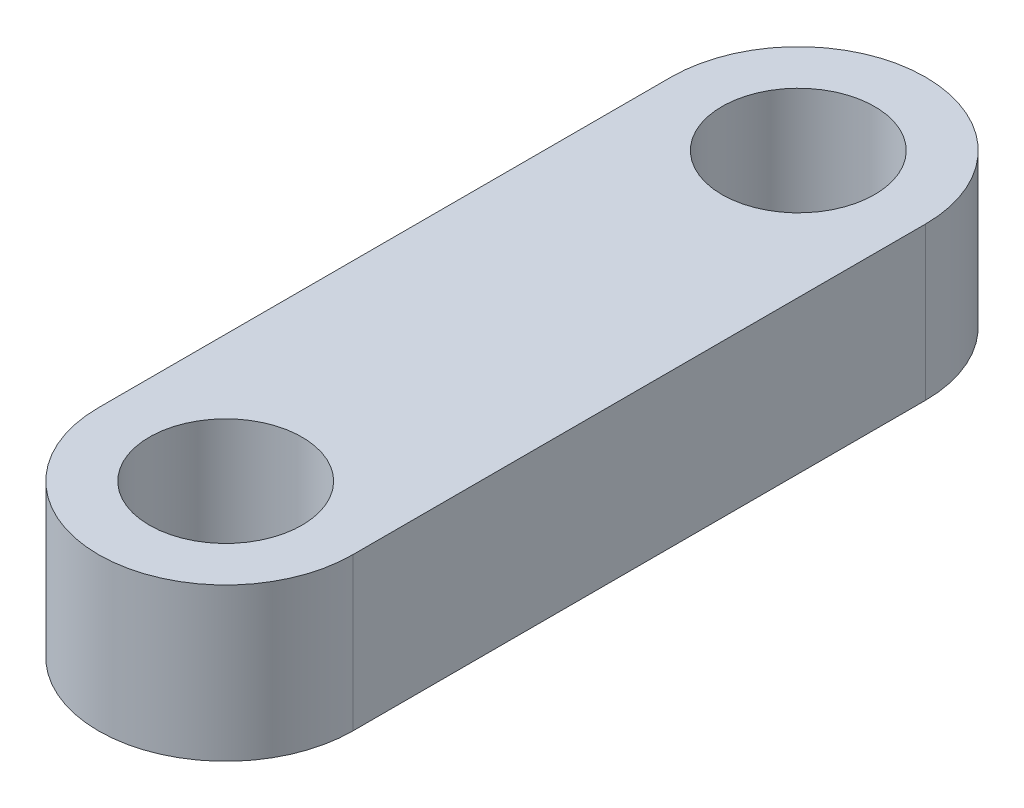
from build123d import *

# Parameters (mm, degrees)
SKETCH1_R           = 3
BOSS_EXTRUDE1_DEPTH = 6


with BuildPart() as part:
    # Sketch1 → Boss-Extrude1 (new body)
    with BuildSketch(Plane(origin=(0, 0, 0), x_dir=(1, 0, 0), z_dir=(0, 1, 0))):
        with BuildLine():
            Line((-5, 11.25), (-5, -11.25))
            ThreePointArc((-5, -11.25), (0, -16.25), (5, -11.25))
            Line((5, -11.25), (5, 11.25))
            ThreePointArc((5, 11.25), (0, 16.25), (-5, 11.25))
        make_face()
        with Locations((0, 11.25)):
            Circle(SKETCH1_R, mode=Mode.SUBTRACT)
        with Locations((0, -11.25)):
            Circle(SKETCH1_R, mode=Mode.SUBTRACT)
    extrude(amount=BOSS_EXTRUDE1_DEPTH)


solid = part.part
